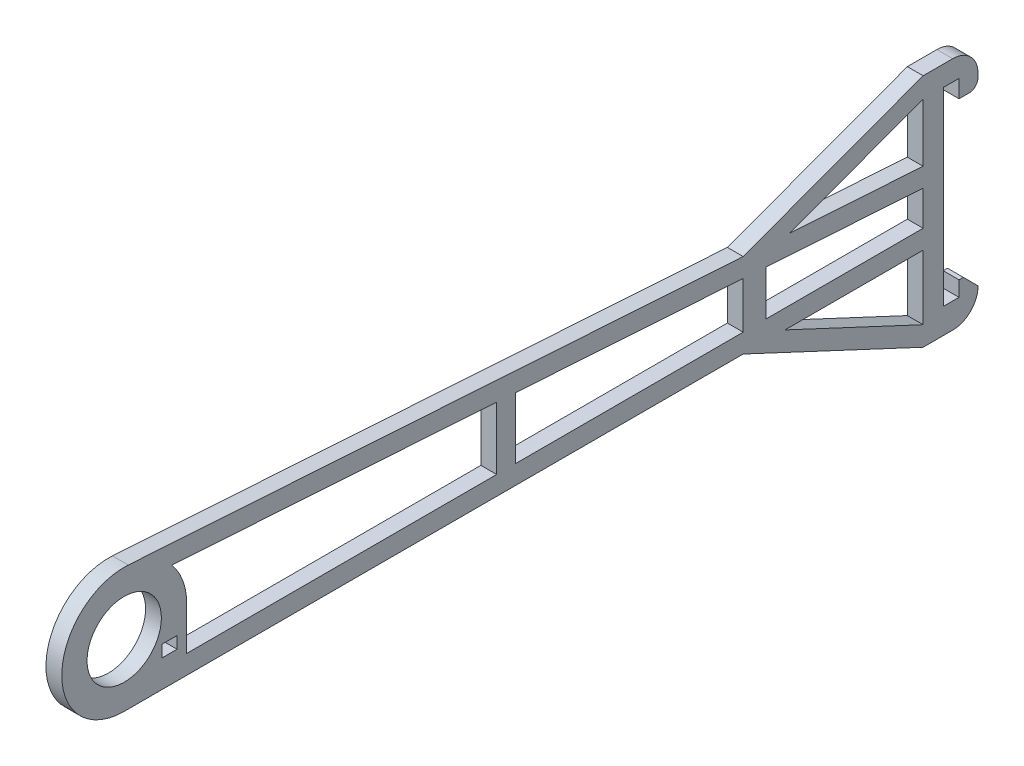
from build123d import *

# Parameters (mm, degrees)
SKETCH1_W           = 1.5113
SKETCH1_H           = 1.1938
SKETCH1_R           = 3.7338
BOSS_EXTRUDE1_DEPTH = 1.5875


with BuildPart() as part:
    # Sketch1 → Boss-Extrude1 (new body)
    with BuildSketch(Plane(origin=(0, 0, 0), x_dir=(0, 0, -1), z_dir=(1, 0, 0))):
        with BuildLine():
            Line((62.185099246, 2.211808127), (0.410288477, 6.260369782))
            ThreePointArc((0.410288477, 6.260369782), (-6.270441547, 0.205254114), (0, -6.2738))
            Line((0, -6.2738), (62.185099246, -6.2738))
            Line((62.185099246, -6.2738), (80.264, -14.721036366))
            Line((80.264, -14.721036366), (83.2358, -14.721036366))
            ThreePointArc((83.2358, -14.721036366), (85.031851224, -13.97708759), (85.7758, -12.181036366))
            Line((85.7758, -12.181036366), (85.7758, -12.130236366))
            Line((85.7758, -12.130236366), (84.3026, -10.657036366))
            Line((84.3026, -10.657036366), (83.8708, -10.657036366))
            Line((83.8708, -10.657036366), (83.8708, -12.181036366))
            Line((83.8708, -12.181036366), (82.296, -12.181036366))
            Line((82.296, -12.181036366), (82.296, 6.868963634))
            Line((82.296, 6.868963634), (83.8708, 6.868963634))
            Line((83.8708, 6.868963634), (83.8708, 5.090963634))
            Line((83.8708, 5.090963634), (84.8868, 5.090963634))
            ThreePointArc((84.8868, 5.090963634), (85.515417928, 5.351345706), (85.7758, 5.979963634))
            Line((85.7758, 5.979963634), (85.7758, 6.360963634))
            ThreePointArc((85.7758, 6.360963634), (85.031851224, 8.157014859), (83.2358, 8.900963634))
            Line((83.2358, 8.900963634), (80.264, 8.900963634))
            Line((80.264, 8.900963634), (62.185099246, 2.211808127))
        make_face()
        with BuildLine():
            Line((37.420099246, -4.3688), (6.2738, -4.3688))
            Line((6.2738, -4.3688), (6.2738, 0))
            ThreePointArc((6.2738, 0), (5.888187094, 2.165599038), (4.778751005, 4.064985273))
            Line((4.778751005, 4.064985273), (37.420099246, 1.925755558))
            Line((37.420099246, 1.925755558), (37.420099246, -4.3688))
        make_face(mode=Mode.SUBTRACT)
        Polygon((62.185099246, -4.3688), (39.325099246, -4.3688), (39.325099246, 1.800906775), (62.185099246, 0.302721378), align=None, mode=Mode.SUBTRACT)
        Polygon((80.264, -4.3688), (64.471099246, -4.3688), (64.471099246, 0.152902838), (80.264, -0.882123115), align=None, mode=Mode.SUBTRACT)
        Polygon((80.264, -12.758527161), (66.3852906, -6.2738), (80.264, -6.2738), align=None, mode=Mode.SUBTRACT)
        Polygon((80.264, 1.026963634), (66.848818814, 1.906159984), (80.264, 6.869748995), align=None, mode=Mode.SUBTRACT)
        with Locations((4.55295, -2.921)):
            Rectangle(SKETCH1_W, SKETCH1_H, mode=Mode.SUBTRACT)
        Circle(SKETCH1_R, mode=Mode.SUBTRACT)
    extrude(amount=BOSS_EXTRUDE1_DEPTH)


solid = part.part
